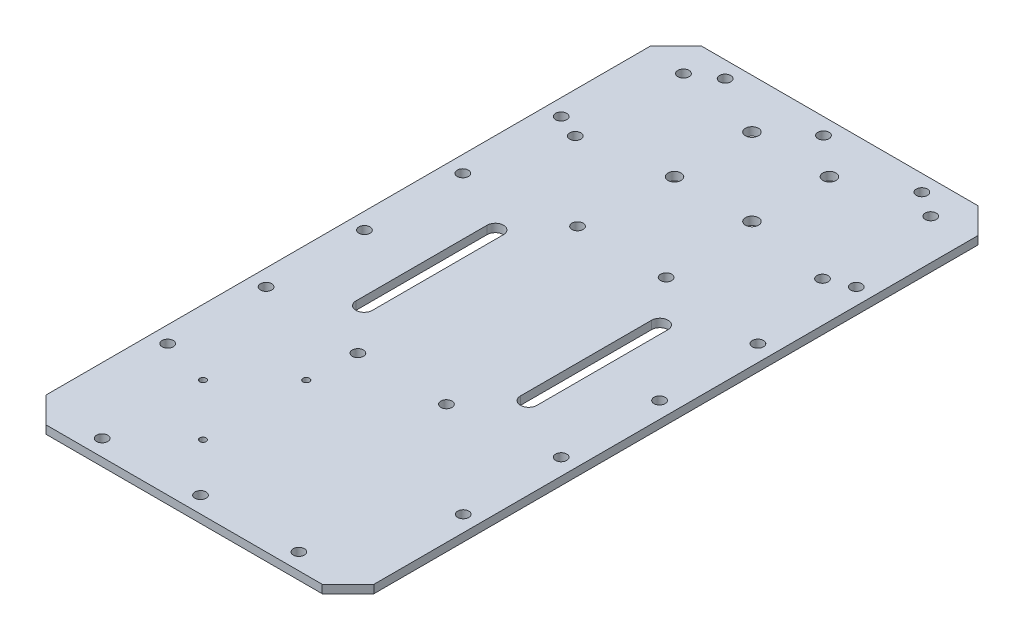
from build123d import *

# Parameters (mm, degrees)
SKETCH2_R           = 2.159
SKETCH2_R_2         = 1.25
SKETCH2_R_3         = 2.54
BOSS_EXTRUDE1_DEPTH = 3.175


with BuildPart() as part:
    # Sketch2 → Boss-Extrude1 (new body)
    with BuildSketch(Plane(origin=(0, 0, 0), x_dir=(1, 0, 0), z_dir=(0, 1, 0))):
        Polygon((0, 244), (0, 10), (10, 0), (117, 0), (127, 10), (127, 244), (117, 254), (10, 254), align=None)
        with Locations((25.4, 6.35)):
            Circle(SKETCH2_R, mode=Mode.SUBTRACT)
        with Locations((6.35, 50.8)):
            Circle(SKETCH2_R, mode=Mode.SUBTRACT)
        with Locations((25.4, 45.4)):
            Circle(SKETCH2_R_2, mode=Mode.SUBTRACT)
        with Locations((45.4, 25.4)):
            Circle(SKETCH2_R_2, mode=Mode.SUBTRACT)
        with Locations((6.35, 88.9)):
            Circle(SKETCH2_R, mode=Mode.SUBTRACT)
        with Locations((45.4, 65.4)):
            Circle(SKETCH2_R_2, mode=Mode.SUBTRACT)
        with Locations((46.355, 84.455)):
            Circle(SKETCH2_R, mode=Mode.SUBTRACT)
        with Locations((63.5, 6.35)):
            Circle(SKETCH2_R, mode=Mode.SUBTRACT)
        with Locations((101.6, 6.35)):
            Circle(SKETCH2_R, mode=Mode.SUBTRACT)
        with Locations((120.81, 50.8)):
            Circle(SKETCH2_R, mode=Mode.SUBTRACT)
        with Locations((80.645, 84.455)):
            Circle(SKETCH2_R, mode=Mode.SUBTRACT)
        with Locations((120.65, 88.9)):
            Circle(SKETCH2_R, mode=Mode.SUBTRACT)
        with Locations((6.35, 127)):
            Circle(SKETCH2_R, mode=Mode.SUBTRACT)
        with BuildLine():
            Line((34.808835003, 114.3), (34.808835003, 101.6))
            ThreePointArc((34.808835003, 101.6), (31.633835003, 98.425), (28.458835003, 101.6))
            Line((28.458835003, 101.6), (28.458835003, 139.7))
            Line((28.458835003, 139.7), (28.458835003, 152.4))
            ThreePointArc((28.458835003, 152.4), (31.633835003, 155.575), (34.808835003, 152.4))
            Line((34.808835003, 152.4), (34.808835003, 139.7))
            Line((34.808835003, 139.7), (34.808835003, 114.3))
        make_face(mode=Mode.SUBTRACT)
        with Locations((6.35, 165.1)):
            Circle(SKETCH2_R, mode=Mode.SUBTRACT)
        with Locations((46.355, 169.545)):
            Circle(SKETCH2_R, mode=Mode.SUBTRACT)
        with Locations((6.35, 203.2)):
            Circle(SKETCH2_R, mode=Mode.SUBTRACT)
        with Locations((15.621, 199.39)):
            Circle(SKETCH2_R, mode=Mode.SUBTRACT)
        with Locations((15.621, 241.3)):
            Circle(SKETCH2_R, mode=Mode.SUBTRACT)
        with Locations((25.4, 247.65)):
            Circle(SKETCH2_R, mode=Mode.SUBTRACT)
        with Locations((48.50003, 204.95006)):
            Circle(SKETCH2_R_3, mode=Mode.SUBTRACT)
        with Locations((48.50003, 234.95)):
            Circle(SKETCH2_R_3, mode=Mode.SUBTRACT)
        with Locations((80.645, 169.545)):
            Circle(SKETCH2_R, mode=Mode.SUBTRACT)
        with BuildLine():
            Line((92.191164997, 127), (92.191164997, 152.4))
            ThreePointArc((92.191164997, 152.4), (95.366164997, 155.575), (98.541164997, 152.4))
            Line((98.541164997, 152.4), (98.541164997, 101.6))
            ThreePointArc((98.541164997, 101.6), (95.366164997, 98.425), (92.191164997, 101.6))
            Line((92.191164997, 101.6), (92.191164997, 127))
        make_face(mode=Mode.SUBTRACT)
        with Locations((120.65, 127)):
            Circle(SKETCH2_R, mode=Mode.SUBTRACT)
        with Locations((120.65, 165.1)):
            Circle(SKETCH2_R, mode=Mode.SUBTRACT)
        with Locations((78.49997, 204.95006)):
            Circle(SKETCH2_R_3, mode=Mode.SUBTRACT)
        with Locations((78.49997, 234.95)):
            Circle(SKETCH2_R_3, mode=Mode.SUBTRACT)
        with Locations((63.5, 247.65)):
            Circle(SKETCH2_R, mode=Mode.SUBTRACT)
        with Locations((111.379, 199.39)):
            Circle(SKETCH2_R, mode=Mode.SUBTRACT)
        with Locations((120.65, 203.2)):
            Circle(SKETCH2_R, mode=Mode.SUBTRACT)
        with Locations((101.6, 247.65)):
            Circle(SKETCH2_R, mode=Mode.SUBTRACT)
        with Locations((111.379, 241.3)):
            Circle(SKETCH2_R, mode=Mode.SUBTRACT)
    extrude(amount=BOSS_EXTRUDE1_DEPTH)


solid = part.part
